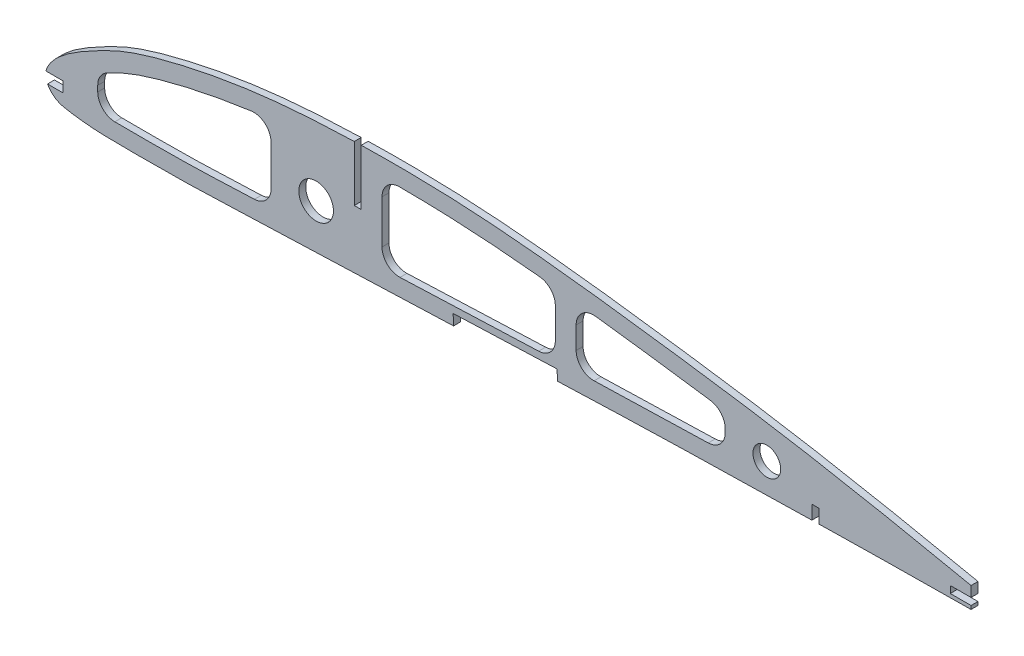
from build123d import *

# Parameters (mm, degrees)
SKETCH_1_R          = 5
SKETCH_1_R_2        = 4
EXTRUDE_1_DEPTH     = 2
CUT_EXTRUDE_2_DEPTH = 2


# Read off the part's stored shape, not the designer's step: 切除-拉伸2
with BuildPart() as part:
    # 草图1 → 凸台-拉伸1 (new body)
    with BuildSketch(Plane.XY):
        with BuildLine():
            Line((90, 12.3715), (90, 28.372426217))
            add(Edge.make_bspline(
                [(90, 28.372426217), (89.259446982, 28.350928743), (82.363996343, 28.13322439), (72.403347361, 27.586524792), (60.185862052, 26.226268085), (51.080991088, 24.79810862), (42.033943524, 23.000087944), (34.581994337, 21.174922903), (28.697351661, 19.44563851), (24.361981086, 17.983441115), (20.174828998, 16.207949367), (16.078941989, 14.139912989), (12.040296713, 11.946766626), (8.14011433, 9.56039573), (5.153679337, 7.316395724), (3.100060439, 5.200618052), (1.813825976, 3.470730924), (1.237398467, 2.180506339), (1.085380705, 1.529058937), (1.078882286, 1.5)],
                knots=[0.345773533, 0.345773533, 0.345773533, 0.345773533, 0.349398211, 0.379527288, 0.394591827, 0.409656366, 0.424720905, 0.439785444, 0.447317713, 0.454849983, 0.462382252, 0.469914522, 0.477446791, 0.484979061, 0.49251133, 0.496277465, 0.5000436, 0.503809734, 0.503985678, 0.503985678, 0.503985678, 0.503985678], degree=3))
            Line((1.078882286, 1.5), (6, 1.5))
            Line((6, 1.5), (6, -1.5))
            Line((6, -1.5), (1.522379628, -1.5))
            add(Edge.make_bspline(
                [(1.522379628, -1.5), (1.617903461, -1.678770523), (2.068186491, -2.42442122), (3.143139608, -3.601090845), (4.854253, -4.619355756), (6.927567017, -5.105597911), (9.209034621, -5.454839075), (12.219971865, -5.84289763), (16.020132359, -6.14266222), (20.609524976, -6.2611368), (25.231457517, -6.286948592), (31.397380169, -6.280305851), (39.107274969, -6.240736398), (48.336813051, -6.022096429), (57.579935967, -5.612990736), (66.840654471, -5.242934226), (76.096556555, -4.921715721), (88.435998513, -4.515955408), (103.853120896, -3.973102953), (122.354625015, -3.248110744), (140.857835973, -2.495489966), (159.368527813, -1.804089638), (177.884173919, -1.222493213), (196.4033921, -0.774877257), (211.106034353, -0.46143934), (219.638958118, -0.28014938), (222, -0.231405833)],
                knots=[0.510182255, 0.510182255, 0.510182255, 0.510182255, 0.511342004, 0.515108139, 0.518874273, 0.522640408, 0.526406543, 0.530172677, 0.537704947, 0.545237216, 0.552769486, 0.560301755, 0.575366294, 0.590430833, 0.605495372, 0.620559911, 0.63562445, 0.650688989, 0.680818067, 0.710947144, 0.741076222, 0.7712053, 0.801334378, 0.831463456, 0.861592533, 0.873117312, 0.873117312, 0.873117312, 0.873117312], degree=3))
            Line((222, -0.231405833), (222, 3.768284765))
            Line((222, 3.768284765), (224, 3.768284765))
            Line((224, 3.768284765), (224, -0.190486213))
            add(Edge.make_bspline(
                [(224, -0.190486213), (227.14486696, -0.126773539), (236.463303784, 0.052517956), (251.961175933, 0.256656825), (270.471854229, 0.429163033), (282.824771355, 0.587434741), (289, 0.610062865)],
                knots=[0.8763714, 0.8763714, 0.8763714, 0.8763714, 0.891721611, 0.921850689, 0.951979767, 0.982108845, 0.982108845, 0.982108845, 0.982108845], degree=3))
            Line((289, 0.610062865), (289, 1.816246039))
            add(Edge.make_bspline(
                [(289, 1.816246039), (276.957314444, 4.502285023), (258.861554155, 8.397620333), (234.648247971, 13.152786595), (216.448478593, 16.478914183), (198.182873559, 19.371550405), (179.850571346, 21.924148488), (161.503162682, 24.358614825), (143.127892269, 26.473190985), (124.712239059, 28.043780086), (107.661076739, 28.627794226), (96.749283398, 28.541845307), (92, 28.425883181)],
                knots=[0.017978355, 0.017978355, 0.017978355, 0.017978355, 0.07823651, 0.108365588, 0.138494666, 0.168623744, 0.198752821, 0.228881899, 0.259010977, 0.289140055, 0.319269133, 0.342510787, 0.342510787, 0.342510787, 0.342510787], degree=3))
            Line((92, 28.425883181), (92, 12.3715))
            Line((92, 12.3715), (90, 12.3715))
        make_face()
        with Locations((79, 8)):
            Circle(SKETCH_1_R, mode=Mode.SUBTRACT)
        with Locations((209, 8)):
            Circle(SKETCH_1_R_2, mode=Mode.SUBTRACT)
    extrude(amount=EXTRUDE_1_DEPTH)

    # 切除-拉伸2 outline → 切除-拉伸2 (cut)
    with BuildSketch(Plane.XY):
        with BuildLine():
            ThreePointArc((98, 6.014495108), (99.530624101, 2.414018629), (103.18537235, 1.01793258))
            add(Edge.make_bspline(
                [(103.18537235, 1.01793258), (105.560867454, 1.106063391), (107.936437779, 1.195881883), (119.590927656, 1.6441911), (128.873439493, 2.026235766), (139.842898274, 2.458620096), (141.517508233, 2.523944638), (143.192405577, 2.588444329)],
                knots=[0.467989967, 0.467989967, 0.467989967, 0.467989967, 0.5, 0.5, 0.625, 0.625, 0.647515554, 0.647515554, 0.647515554, 0.647515554], degree=3))
            ThreePointArc((143.192405577, 2.588444329), (146.602917421, 4.117900034), (148, 7.584740967))
            Line((148, 7.584740967), (148, 16.344040065))
            ThreePointArc((148, 16.344040065), (146.709868743, 19.696184738), (143.505250436, 21.318446763))
            add(Edge.make_bspline(
                [(143.505250436, 21.318446763), (142.733269268, 21.396856882), (141.961371617, 21.473825477), (137.095631637, 21.949495859), (133.006687672, 22.305846232), (124.838758232, 22.891937538), (120.76027081, 23.118394336), (112.589349819, 23.431909041), (108.50024347, 23.520641418), (103.942207816, 23.54715361), (103.476725809, 23.549024612), (103.011200556, 23.550067443)],
                knots=[0.738217106, 0.738217106, 0.738217106, 0.738217106, 0.75, 0.75, 0.8125, 0.8125, 0.875, 0.875, 0.9375, 0.9375, 0.944607852, 0.944607852, 0.944607852, 0.944607852], degree=3))
            ThreePointArc((103.011200556, 23.550067443), (99.468428309, 22.089571673), (98, 18.550079988))
            Line((98, 18.550079988), (98, 6.014495108))
        make_face()
        with BuildLine():
            ThreePointArc((154, 8.170617563), (155.525809704, 4.574786396), (159.172000715, 3.173576864))
            add(Edge.make_bspline(
                [(159.172000715, 3.173576864), (161.473677828, 3.252801775), (163.775686209, 3.329549926), (170.732455506, 3.552774746), (175.388689917, 3.690754395), (184.07020031, 3.924521784), (188.094738333, 4.024115619), (192.117455336, 4.118639618)],
                knots=[0.71908585, 0.71908585, 0.71908585, 0.71908585, 0.75, 0.75, 0.8125, 0.8125, 0.866546799, 0.866546799, 0.866546799, 0.866546799], degree=3))
            ThreePointArc((192.117455336, 4.118639618), (195.576819584, 5.623499462), (197, 9.117259852))
            Line((197, 9.117259852), (197, 10.112022474))
            ThreePointArc((197, 10.112022474), (195.77958016, 13.385365385), (192.714090476, 15.060767244))
            add(Edge.make_bspline(
                [(192.714090476, 15.060767244), (191.944613201, 15.171800732), (191.174825659, 15.282099728), (186.308954619, 15.974755997), (182.203786583, 16.539615577), (173.988030512, 17.653320176), (169.883033971, 18.199812389), (163.72254432, 18.989569369), (161.665308348, 19.2482867), (159.608604404, 19.500505924)],
                knots=[0.488248297, 0.488248297, 0.488248297, 0.488248297, 0.5, 0.5, 0.5625, 0.5625, 0.625, 0.625, 0.656347088, 0.656347088, 0.656347088, 0.656347088], degree=3))
            ThreePointArc((159.608604404, 19.500505924), (155.686619703, 18.282214891), (154, 14.537684078))
            Line((154, 14.537684078), (154, 8.170617563))
        make_face()
        with BuildLine():
            ThreePointArc((16, 3.749572283), (17.43862744, 0.240067263), (20.926650195, -1.249889668))
            add(Edge.make_bspline(
                [(20.926650195, -1.249889668), (21.774172276, -1.262324122), (22.628944162, -1.270076322), (24.631357544, -1.281688823), (25.78455057, -1.283642157), (29.246278981, -1.283863887), (31.564498991, -1.277624199), (36.178821914, -1.249716978), (38.477208261, -1.225805817), (43.065916773, -1.143353772), (45.357830447, -1.085798853), (49.942071524, -0.935363079), (52.243600435, -0.841029597), (56.765262425, -0.649905427), (58.983967724, -0.555595534), (61.201389308, -0.466209999)],
                knots=[0.097664849, 0.097664849, 0.097664849, 0.097664849, 0.109375, 0.109375, 0.125, 0.125, 0.15625, 0.15625, 0.1875, 0.1875, 0.21875, 0.21875, 0.25, 0.25, 0.279748342, 0.279748342, 0.279748342, 0.279748342], degree=3))
            ThreePointArc((61.201389308, -0.466209999), (64.606032899, 1.066132334), (66, 4.529732589))
            Line((66, 4.529732589), (66, 16.175207171))
            ThreePointArc((66, 16.175207171), (64.287676463, 19.942325894), (60.32352661, 21.129234195))
            add(Edge.make_bspline(
                [(60.32352661, 21.129234195), (59.143282742, 20.968071656), (57.964431768, 20.796736398), (53.109249428, 20.046773379), (49.445857595, 19.384253181), (42.158673028, 17.868714577), (38.533379611, 17.019586343), (33.148990447, 15.546220745), (31.362942012, 15.022439399), (27.821005995, 13.880218625), (26.067238608, 13.253271835), (22.635818059, 11.812670552), (20.957942753, 11.004847704), (19.099592195, 10.049689097), (18.896441621, 9.944700093), (18.693547477, 9.839213217)],
                knots=[0.029920383, 0.029920383, 0.029920383, 0.029920383, 0.033494004, 0.033494004, 0.044658672, 0.044658672, 0.05582334, 0.05582334, 0.061405674, 0.061405674, 0.066988008, 0.066988008, 0.072570342, 0.072570342, 0.073256353, 0.073256353, 0.073256353, 0.073256353], degree=3))
            ThreePointArc((18.693547477, 9.839213217), (16.726110517, 7.997937304), (16, 5.402967421))
            Line((16, 5.402967421), (16, 3.749572283))
        make_face()
        with BuildLine():
            add(Edge.make_bspline(
                [(289, 1.816246039), (281.978696735, 3.382299906), (274.950202385, 4.918049481), (267.913052859, 6.412186808)],
                knots=[0.017978355, 0.017978355, 0.017978355, 0.017978355, 0.053110949, 0.053110949, 0.053110949, 0.053110949], degree=3))
            Line((267.913052859, 6.412186808), (267.913052859, 3.412186808))
            Line((267.913052859, 3.412186808), (261.913052859, 3.412186808))
            Line((261.913052859, 3.412186808), (261.913052859, 1.412186808))
            Line((261.913052859, 1.412186808), (267.913052859, 1.412186808))
            Line((267.913052859, 1.412186808), (267.913052859, 0.412186808))
            add(Edge.make_bspline(
                [(267.913052859, 0.412186808), (268.766976108, 0.421284301), (275.793854693, 0.497351146), (282.824771355, 0.587434741), (289, 0.610062865)],
                knots=[0.947811677, 0.947811677, 0.947811677, 0.947811677, 0.951979767, 0.982108845, 0.982108845, 0.982108845, 0.982108845], degree=3))
            Line((289, 0.610062865), (289, 1.816246039))
        make_face()
        with BuildLine():
            Line((148.502662677, 0.788581965), (118.523611267, -0.331640805))
            Line((118.523611267, -0.331640805), (118.637941387, -3.391307734))
            add(Edge.make_bspline(
                [(118.637941387, -3.391307734), (119.876919949, -3.342267709), (127.283304342, -3.047636001), (137.274566127, -2.641239984), (146.029280896, -2.305788873), (148.614677353, -2.20911975)],
                knots=[0.704894411, 0.704894411, 0.704894411, 0.704894411, 0.710947144, 0.741076222, 0.753701211, 0.753701211, 0.753701211, 0.753701211], degree=3))
            Line((148.614677353, -2.20911975), (148.502662677, 0.788581965))
        make_face()
    extrude(amount=CUT_EXTRUDE_2_DEPTH, mode=Mode.SUBTRACT)


solid = part.part
